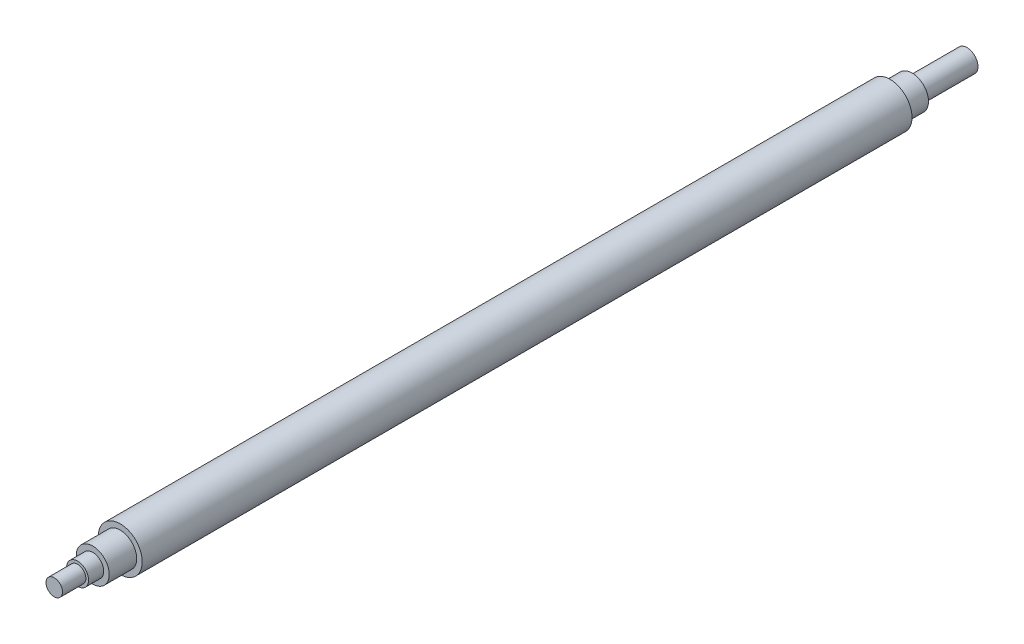
from build123d import *


with BuildPart() as part:
    # Schizzo2 → Rivoluzione2 (revolve)
    with BuildSketch(Plane(origin=(0, 0, 0), x_dir=(0, 0, -1), z_dir=(1, 0, 0))):
        Polygon((0, 0), (0, 3), (8.5, 3), (8.5, 4), (14, 4), (14, 6), (24, 6), (24, 8), (304, 8), (304, 6), (312, 6), (312, 4), (332, 4), (332, 0), align=None)
    revolve(axis=Axis((0, 0, 0), (0, 0, -1)))


solid = part.part
